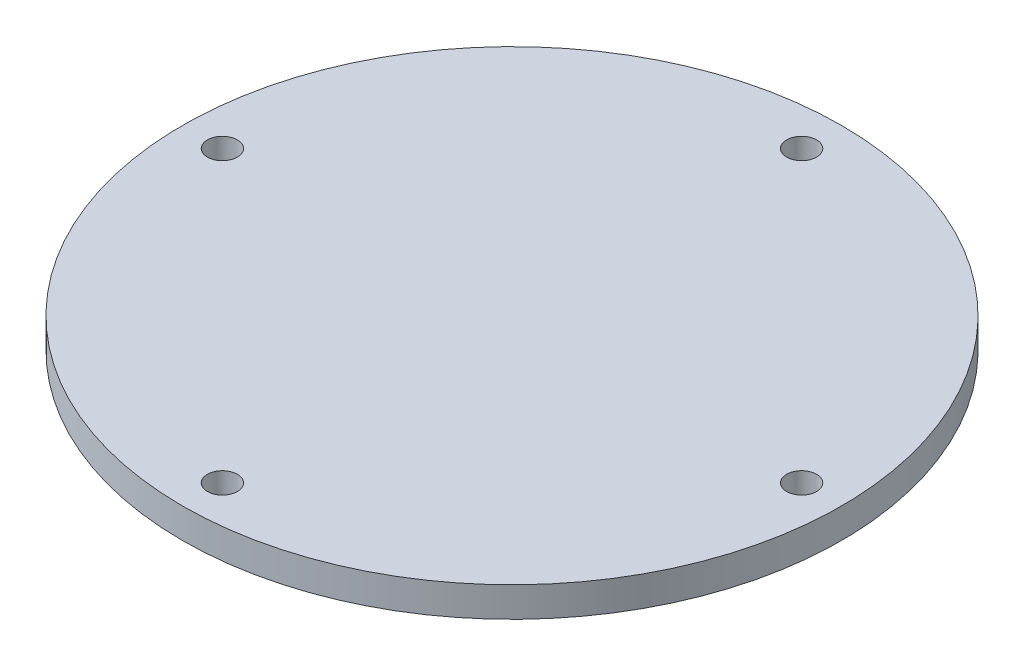
from build123d import *

# Parameters (mm, degrees)
SKETCH1_R           = 33
SKETCH1_R_2         = 1.5
BOSS_EXTRUDE1_DEPTH = 3


with BuildPart() as part:
    # Sketch1 → Boss-Extrude1 (new body)
    with BuildSketch(Plane(origin=(0, 0, 0), x_dir=(1, 0, 0), z_dir=(0, 1, 0))):
        Circle(SKETCH1_R)
        with Locations((-29, 0)):
            Circle(SKETCH1_R_2, mode=Mode.SUBTRACT)
        with Locations((0, 29)):
            Circle(SKETCH1_R_2, mode=Mode.SUBTRACT)
        with Locations((29, 0)):
            Circle(SKETCH1_R_2, mode=Mode.SUBTRACT)
        with Locations((0, -29)):
            Circle(SKETCH1_R_2, mode=Mode.SUBTRACT)
    extrude(amount=BOSS_EXTRUDE1_DEPTH)


solid = part.part
